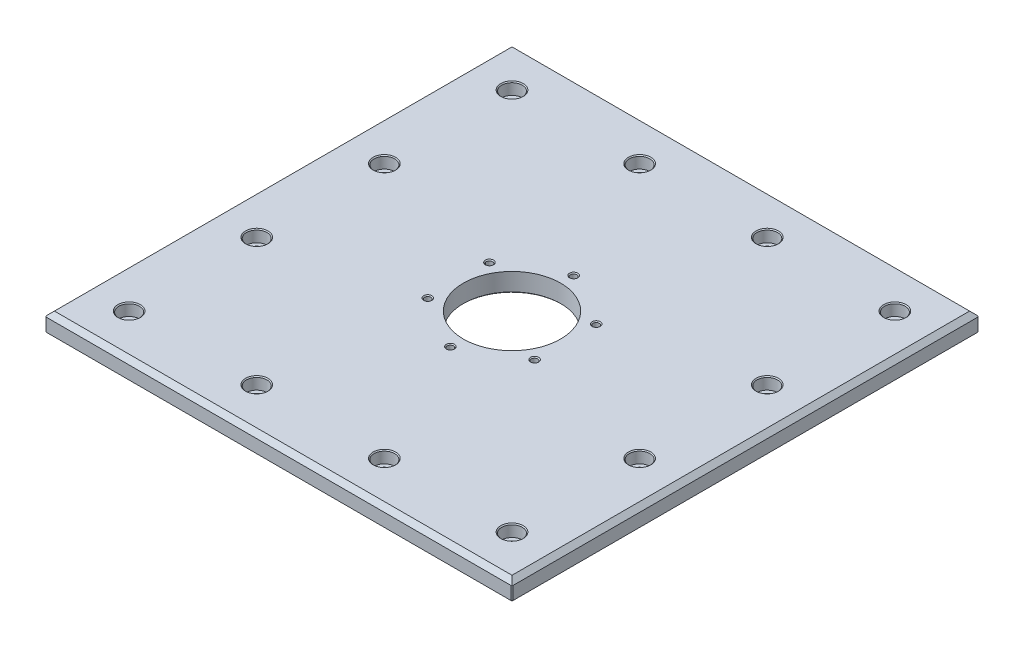
from build123d import *

# Parameters (mm, degrees)
SKETCH1_W                                           = 250
SKETCH1_H                                           = 250
SKETCH1_R                                           = 26
BOSS_EXTRUDE1_DEPTH                                 = 10
M3_CLEARANCE_HOLE1_D                                = 3.4
CBORE_FOR_M6_HEX_SOCKET_HEAD_CAP_SCREW1_D           = 6.6
CBORE_FOR_M6_HEX_SOCKET_HEAD_CAP_SCREW1_CBORE_D     = 11
CBORE_FOR_M6_HEX_SOCKET_HEAD_CAP_SCREW1_CBORE_DEPTH = 6.4
F_2_5MM_CHAMFER1_SIZE                               = 2.5
F_0_5MM_CHAMFER2_SIZE                               = 0.5


with BuildPart() as part:
    # Sketch1 → Boss-Extrude1 (new body)
    with BuildSketch(Plane(origin=(0, 0, 0), x_dir=(1, 0, 0), z_dir=(0, 1, 0))):
        Rectangle(SKETCH1_W, SKETCH1_H)
        Circle(SKETCH1_R, mode=Mode.SUBTRACT)
    extrude(amount=BOSS_EXTRUDE1_DEPTH)

    # M3 Clearance Hole1 (through all)
    with Locations(Plane(origin=(0, 10, 0), x_dir=(1, 0, 0), z_dir=(0, 1, 0))):
        with Locations((0, 33), (28.578838325, 16.5), (28.578838325, -16.5), (0, -33), (-28.578838325, -16.5), (-28.578838325, 16.5)):
            Hole(M3_CLEARANCE_HOLE1_D / 2)

    # CBORE for M6 Hex Socket Head Cap Screw1 (through all)
    with Locations(Plane(origin=(0, 10, 0), x_dir=(1, 0, 0), z_dir=(0, 1, 0))):
        with Locations((-102.5, 102.5), (-34.16666667, 102.5), (34.16666666, 102.5), (102.5, 102.5), (102.49999999, 34.16666667), (102.49999999, -34.16666666), (102.5, -102.5), (34.16666666, -102.49999999), (-34.16666667, -102.49999999), (-102.5, -102.5), (-102.5, -34.16666666), (-102.5, 34.16666667)):
            CounterBoreHole(CBORE_FOR_M6_HEX_SOCKET_HEAD_CAP_SCREW1_D / 2, CBORE_FOR_M6_HEX_SOCKET_HEAD_CAP_SCREW1_CBORE_D / 2, CBORE_FOR_M6_HEX_SOCKET_HEAD_CAP_SCREW1_CBORE_DEPTH)

    # 2,5mm Chamfer1
    f_2_5mm_chamfer1_edges = [part.edges().sort_by_distance(p)[0] for p in [
        (-125, 10, 0),
        (0, 10, -125),
        (125, 10, 0),
        (0, 10, 125),
    ]]
    chamfer(f_2_5mm_chamfer1_edges, length=F_2_5MM_CHAMFER1_SIZE)

    # 0,5mm Chamfer2
    f_0_5mm_chamfer2_edges = [part.edges().sort_by_distance(p)[0] for p in [
        (-26, 0, 0),
        (-26.878838325, 0, -16.5),
        (-26.878838325, 0, 16.5),
        (1.7, 0, 33),
        (30.278838325, 0, 16.5),
        (30.278838325, 0, -16.5),
        (1.7, 0, -33),
        (-99.2, 0, -34.16666667),
        (-99.2, 0, 34.16666666),
        (-99.2, 0, 102.5),
        (-30.86666667, 0, 102.49999999),
        (37.46666666, 0, 102.49999999),
        (105.8, 0, 102.5),
        (105.79999999, 0, 34.16666666),
        (105.79999999, 0, -34.16666667),
        (105.8, 0, -102.5),
        (37.46666666, 0, -102.5),
        (-30.86666667, 0, -102.5),
        (-99.2, 0, -102.5),
        (-26.878838325, 10, -16.5),
        (1.7, 10, -33),
        (-26.878838325, 10, 16.5),
        (1.7, 10, 33),
        (30.278838325, 10, 16.5),
        (30.278838325, 10, -16.5),
        (28.66666666, 10, -102.5),
        (-39.66666667, 10, -102.5),
        (-108, 10, -102.5),
        (-108, 10, -34.16666667),
        (-108, 10, 34.16666666),
        (-108, 10, 102.5),
        (-39.66666667, 10, 102.49999999),
        (28.66666666, 10, 102.49999999),
        (96.99999999, 10, -34.16666667),
        (97, 10, -102.5),
        (96.99999999, 10, 34.16666666),
        (97, 10, 102.5),
        (125, 0, 0),
        (125, 3.75, 125),
        (0, 0, 125),
        (-125, 3.75, 125),
        (-125, 0, 0),
        (-125, 3.75, -125),
        (0, 0, -125),
        (125, 3.75, -125),
    ]]
    chamfer(f_0_5mm_chamfer2_edges, length=F_0_5MM_CHAMFER2_SIZE)


solid = part.part
